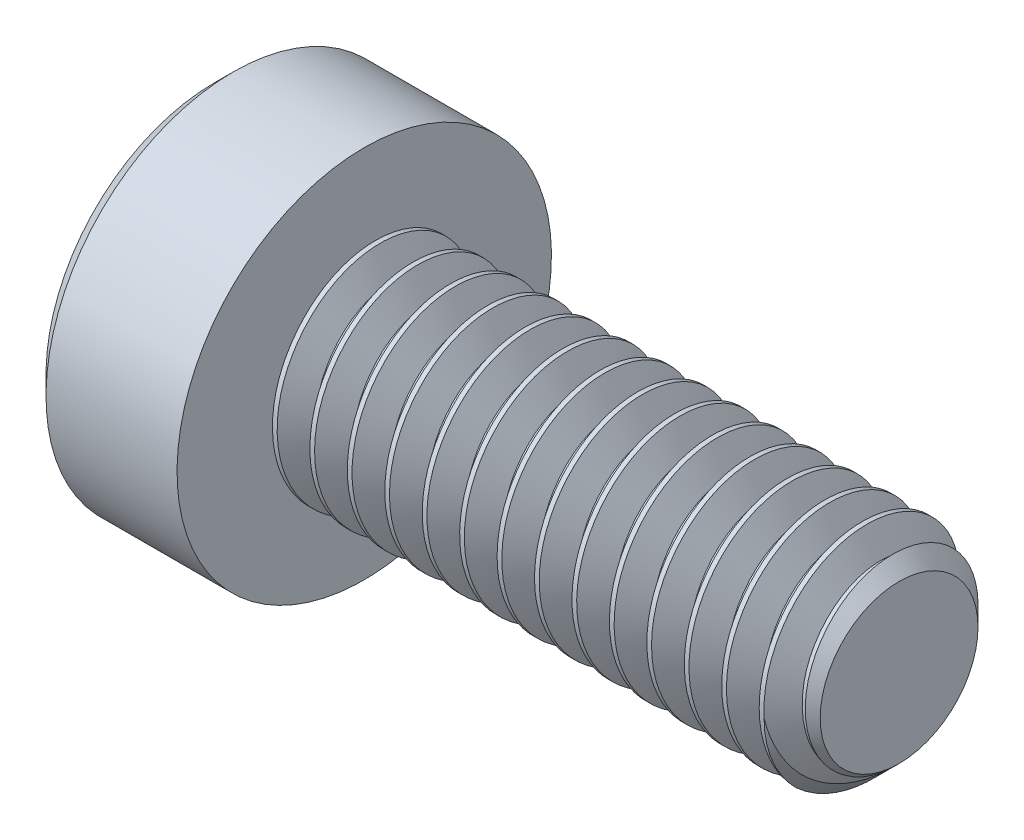
from build123d import *

# Parameters (mm, degrees)
SKETCH2_R           = 2
BOSS_EXTRUDE1_DEPTH = 10
CHAMFER1_SIZE       = 0.525
CUT_SWEEP1_PITCH    = 0.7
CUT_EXTRUDE1_DEPTH  = 2.42


with BuildPart() as part:
    # Sketch2 → Boss-Extrude1 (new body)
    with BuildSketch(Plane(origin=(5, 0, 0), x_dir=(0, 0, -1), z_dir=(1, 0, 0))):
        Circle(SKETCH2_R)
    extrude(amount=-BOSS_EXTRUDE1_DEPTH)

    # Chamfer1
    chamfer1_edges = [part.edges().sort_by_distance(p)[0] for p in [
        (5, 0, 2),
    ]]
    chamfer(chamfer1_edges, length=CHAMFER1_SIZE)

    # Cut-Sweep1: the profile of Sketch5 profile screwed along a right-hand helix of 15.242857 turns, 6 arcs to a turn; built about Z, then put on its axis
    cut_sweep1_z = Axis((0, 0, 0), (0, 0, 1))
    cut_sweep1_corners = [(2.0003, 0, 0.000173205), (2.0003, 0, -0.612673205), (1.545336663, 0, -0.35), (1.545336663, 0, -0.2625)]
    with BuildLine(mode=Mode.PRIVATE) as cut_sweep1_profile:
        Line(cut_sweep1_corners[0], cut_sweep1_corners[1])
        Line(cut_sweep1_corners[1], cut_sweep1_corners[2])
        Line(cut_sweep1_corners[2], cut_sweep1_corners[3])
        Line(cut_sweep1_corners[3], cut_sweep1_corners[0])
    cut_sweep1_cap = Face(cut_sweep1_profile.wire())
    cut_sweep1_turn_angles = [0, 30, 60, 90, 120, 150, 180, 210, 240, 270, 300, 330, 360]
    cut_sweep1_turn_weights = [1, 0.8660254037844387, 1, 0.8660254037844387, 1, 0.8660254037844387, 1, 0.8660254037844387, 1, 0.8660254037844387, 1, 0.8660254037844387, 1]
    cut_sweep1_turn_rails = [Edge.make_bspline([Vector(p[0], p[1], 0).rotate(cut_sweep1_z, cut_sweep1_turn_angles[k]) / cut_sweep1_turn_weights[k] + Vector(0, 0, p[2] + CUT_SWEEP1_PITCH * cut_sweep1_turn_angles[k] / 360) for k in range(13)], [0, 0, 0, 1, 1, 2, 2, 3, 3, 4, 4, 5, 5, 6, 6, 6], 2, cut_sweep1_turn_weights) for p in cut_sweep1_corners]
    cut_sweep1_turn_sides = [Face.make_surface_from_curves(cut_sweep1_turn_rails[p[0]], cut_sweep1_turn_rails[p[1]]) for p in [(0, 1), (1, 2), (2, 3), (3, 0)]]
    cut_sweep1_last_angles = [5400, 5430, 5460, 5473.714285714, 5487.428571429]
    cut_sweep1_last_weights = [1, 0.8660254037844387, 1, 0.9714900382928258, 1]
    cut_sweep1_last_rails = [Edge.make_bspline([Vector(p[0], p[1], 0).rotate(cut_sweep1_z, cut_sweep1_last_angles[k]) / cut_sweep1_last_weights[k] + Vector(0, 0, p[2] + CUT_SWEEP1_PITCH * cut_sweep1_last_angles[k] / 360) for k in range(5)], [0, 0, 0, 1, 1, 2, 2, 2], 2, cut_sweep1_last_weights) for p in cut_sweep1_corners]
    cut_sweep1_last_sides = [Face.make_surface_from_curves(cut_sweep1_last_rails[p[0]], cut_sweep1_last_rails[p[1]]) for p in [(0, 1), (1, 2), (2, 3), (3, 0)]]
    cut_sweep1 = Plane(origin=(5, 0, 0), x_dir=(0, 1, 0), z_dir=(-1, 0, 0)) * Solid(Shell([*[p.moved(Location((0, 0, CUT_SWEEP1_PITCH * i))) for i in range(15) for p in cut_sweep1_turn_sides], *cut_sweep1_last_sides, cut_sweep1_cap, cut_sweep1_cap.rotate(cut_sweep1_z, 5487.428571429).moved(Location((0, 0, CUT_SWEEP1_PITCH * 5487.428571429 / 360)))]))
    add(cut_sweep1, mode=Mode.SUBTRACT)

    # Sketch6 → Revolve1 (revolve)
    with BuildSketch(Plane.XY):
        Polygon((-7.45, 3.5), (-7.8, 3.15), (-7.8, 0), (-5, 0), (-5, 3.5), align=None)
    revolve(axis=Axis((-5, 0, 0), (-1, 0, 0)))

    # Sketch4 → Cut-Extrude1 (cut)
    with BuildSketch(Plane(origin=(-7.8, 0, 0), x_dir=(0, 0, -1), z_dir=(1, 0, 0))):
        Polygon((0, 1.443375673), (-1.25, 0.721687836), (-1.25, -0.721687836), (0, -1.443375673), (1.25, -0.721687836), (1.25, 0.721687836), align=None)
    extrude(amount=CUT_EXTRUDE1_DEPTH, mode=Mode.SUBTRACT)

    # Cut-Extrude2 cone 1 section (through the dimple's axis) → Cut-Extrude2 (revolve, cut)
    with BuildSketch(Plane(origin=(-7.8, 0, 0), x_dir=(0, 0, 1), z_dir=(0, 1, 0))):
        Polygon((0, 0), (1.443375673, 0), (0, 1.443375673), align=None)
    revolve(axis=Axis((-7.8, 0, 0), (1, 0, 0)), mode=Mode.SUBTRACT)


solid = part.part
